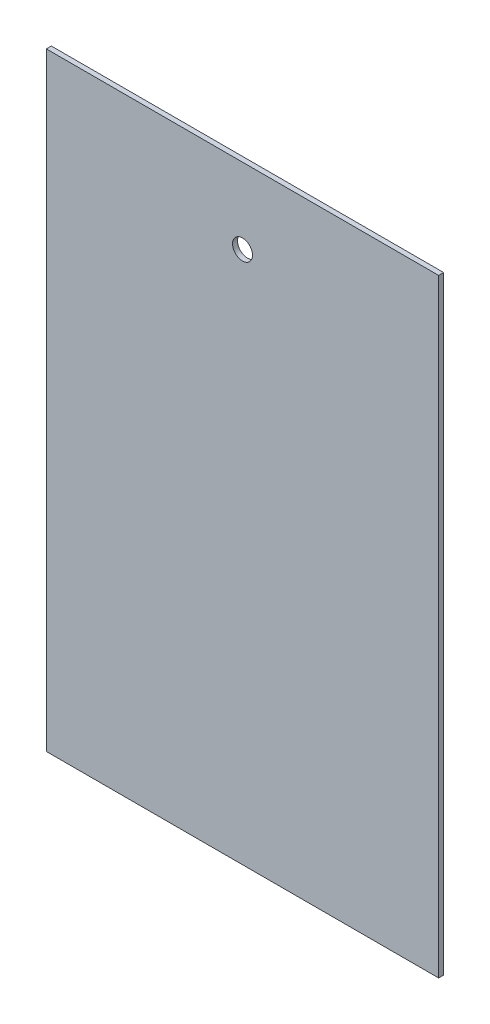
from build123d import *

# Parameters (mm, degrees)
SKETCH1_W           = 236
SKETCH1_H           = 366
BOSS_EXTRUDE1_DEPTH = 3
CUT_EXTRUDE2_REACH  = 219.766
SKETCH2_R           = 6


with BuildPart() as part:
    # Sketch1 → Boss-Extrude1 (new body)
    with BuildSketch(Plane.XY):
        Rectangle(SKETCH1_W, SKETCH1_H)
    extrude(amount=BOSS_EXTRUDE1_DEPTH)

    # Sketch2 → Cut-Extrude2 (cut, up to next)
    with BuildSketch(Plane(origin=(0, 0, 0), x_dir=(-1, 0, 0), z_dir=(0, 0, -1)), mode=Mode.PRIVATE) as cut_extrude2_sk1:
        with Locations((0, 137.5)):
            Circle(SKETCH2_R)
    cut_extrude2_tool1 = extrude(cut_extrude2_sk1.sketch, amount=-CUT_EXTRUDE2_REACH, mode=Mode.PRIVATE) & part.part
    add(cut_extrude2_tool1.solids().sort_by_distance((0, 137.5, 0))[0], mode=Mode.SUBTRACT)


solid = part.part
